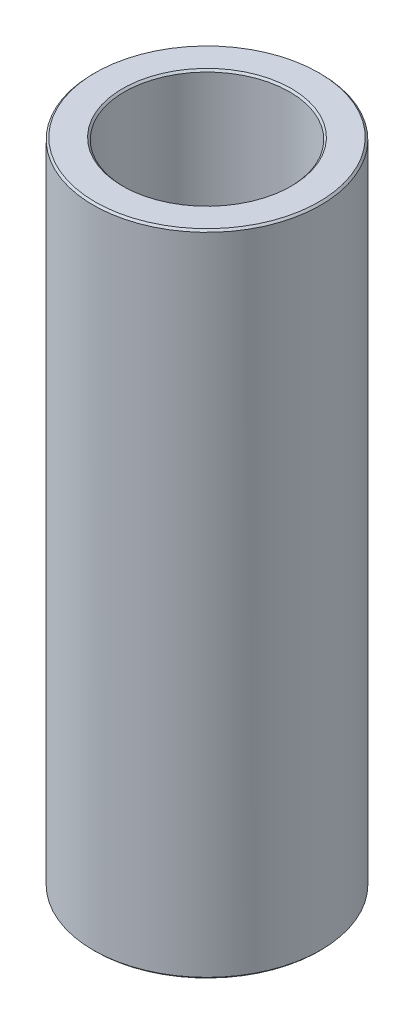
from build123d import *

# Parameters (mm, degrees)
SKETCH1_R           = 40
BOSS_EXTRUDE1_DEPTH = 228.198416368
SKETCH2_R           = 29.047672639
CUT_EXTRUDE1_DEPTH  = 236.105332208
CHAMFER1_SIZE       = 0.655677356


with BuildPart() as part:
    # Sketch1 → Boss-Extrude1 (new body)
    with BuildSketch(Plane(origin=(0, 0, 0), x_dir=(1, 0, 0), z_dir=(0, 1, 0))):
        Circle(SKETCH1_R)
    extrude(amount=BOSS_EXTRUDE1_DEPTH)

    # Sketch2 → Cut-Extrude1 (cut, through all)
    with BuildSketch(Plane(origin=(0, 0, 0), x_dir=(1, 0, 0), z_dir=(0, 1, 0))):
        Circle(SKETCH2_R)
    extrude(amount=CUT_EXTRUDE1_DEPTH, mode=Mode.SUBTRACT)

    # Chamfer1
    chamfer1_edges = [part.edges().sort_by_distance(p)[0] for p in [
        (-29.047672639, 228.198416368, 0),
        (-29.047672639, 0, 0),
        (-40, 0, 0),
        (-40, 228.198416368, 0),
    ]]
    chamfer(chamfer1_edges, length=CHAMFER1_SIZE)


solid = part.part
